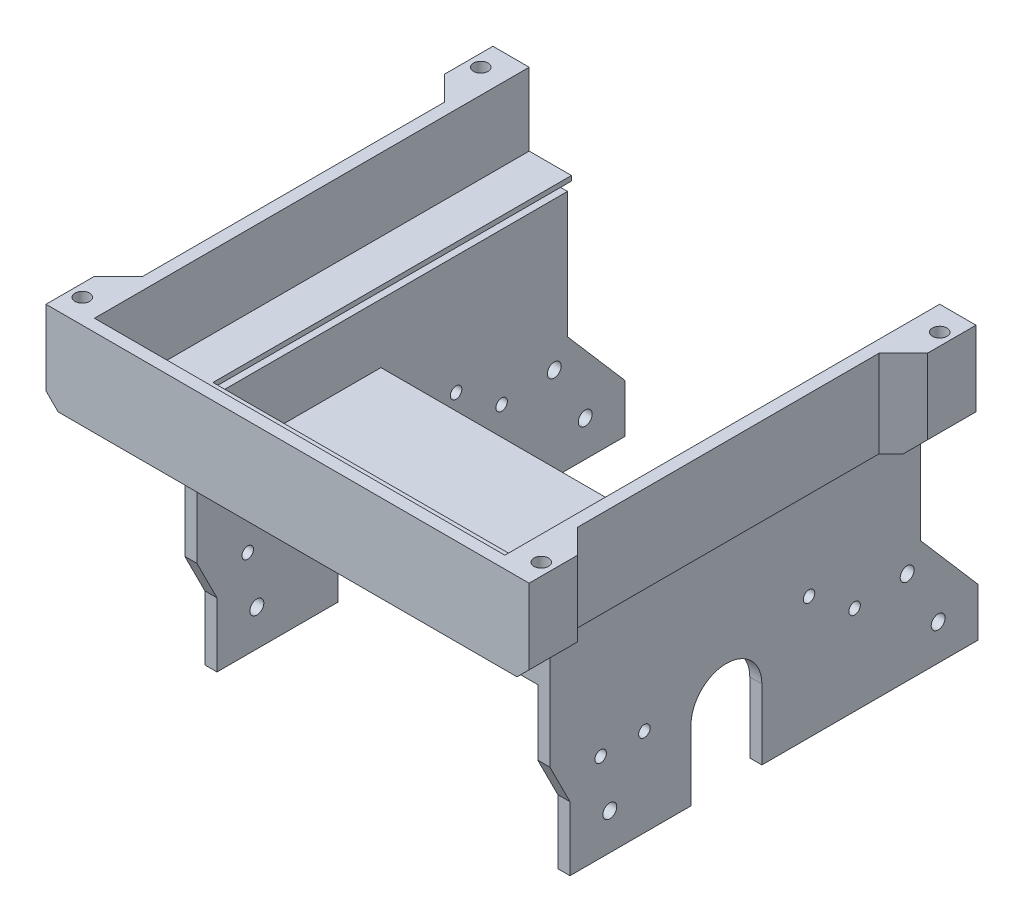
from build123d import *

# Parameters (mm, degrees)
SKETCH_1_W          = 9.5
SKETCH_1_H          = 8
EXTRUDE_1_DEPTH     = 2
SKETCH_2_R          = 1.15
SKETCH_2_R_2        = 0.95
CUT_EXTRUDE_1_DEPTH = 40.502623296
SKETCH_3_W          = 2
SKETCH_3_H          = 61.22
EXTRUDE_2_DEPTH     = 6
SKETCH_4_W          = 61.22
SKETCH_4_H          = 2
EXTRUDE_3_DEPTH     = 58.3
EXTRUDE_START       = -2
SKETCH_5_R          = 0.95
SKETCH_5_R_2        = 1.15
EXTRUDE_4_DEPTH     = 2
EXTRUDE_5_DEPTH     = 61.22
EXTRUDE_6_DEPTH     = 2
SKETCH_10_W         = 1.85
SKETCH_10_H         = 59.22
CUT_EXTRUDE_2_DEPTH = 0.2
SKETCH_11_W         = 0.12
SKETCH_11_H         = 1.8
CUT_EXTRUDE_4_DEPTH = 59.22
CUT_EXTRUDE_START   = -30.82
SKETCH_12_W         = 56.3
SKETCH_12_H         = 2
CUT_EXTRUDE_5_DEPTH = 30.82
EXTRUDE_7_DEPTH     = 10.6
SKETCH_14_W         = 71.82
SKETCH_14_H         = 2.4
EXTRUDE_8_DEPTH     = 1.32
SKETCH_15_W         = 71.82
SKETCH_15_H         = 2.4
EXTRUDE_9_DEPTH     = 2.48
EXTRUDE_10_DEPTH    = 2
SKETCH_17_W         = 73.82
SKETCH_17_H         = 2.4
EXTRUDE_11_DEPTH    = 2
SKETCH_18_W         = 73.82
SKETCH_18_H         = 2.4
EXTRUDE_12_DEPTH    = 2
EXTRUDE_13_DEPTH    = 12
SKETCH_20_W         = 4
SKETCH_20_H         = 8
SKETCH_20_R         = 1.2
EXTRUDE_14_DEPTH    = 10
SKETCH_21_W         = 4
SKETCH_21_H         = 8
EXTRUDE_15_DEPTH    = 3
SKETCH_22_W         = 4
SKETCH_22_H         = 8
EXTRUDE_16_DEPTH    = 4.4
CHAMFER_1_SIZE      = 4
CHAMFER_2_SIZE      = 2
CHAMFER_3_SIZE      = 5


with BuildPart() as part:
    # 草图1 → 凸台-拉伸1 (new body)
    with BuildSketch(Plane(origin=(0, 0, 0), x_dir=(0, 0, -1), z_dir=(1, 0, 0))):
        with BuildLine():
            Line((-2, -13.637332849), (24.2, -13.637332849))
            Line((24.2, -13.637332849), (24.2, -5.637332849))
            Line((24.2, -5.637332849), (24.2, 5.362667151))
            Line((24.2, 5.362667151), (24.2, 10.362667151))
            Line((24.2, 10.362667151), (-37.02, 10.362667151))
            Line((-37.02, 10.362667151), (-37.02, 3.562667151))
            Line((-37.02, 3.562667151), (-33.7, -3.037332849))
            Line((-33.7, -3.037332849), (-33.7, -13.637332849))
            Line((-33.7, -13.637332849), (-13.7, -13.637332849))
            Line((-13.7, -13.637332849), (-13.7, -2.037332849))
            ThreePointArc((-13.7, -2.037332849), (-7.85, 3.812667151), (-2, -2.037332849))
            Line((-2, -2.037332849), (-2, -13.637332849))
        make_face()
        Polygon((24.2, -5.637332849), (33.7, -5.637332849), (24.2, 5.362667151), align=None)
        with Locations((28.95, -9.637332849)):
            Rectangle(SKETCH_1_W, SKETCH_1_H)
    extrude(amount=EXTRUDE_1_DEPTH)

    # 草图2 → 切除-拉伸1 (cut, through all)
    with BuildSketch(Plane(origin=(2, 0, 0), x_dir=(0, 0, -1), z_dir=(1, 0, 0))):
        with Locations((27.12, -7.727332849)):
            Circle(SKETCH_2_R)
        with Locations((-27.12, -7.627332849)):
            Circle(SKETCH_2_R)
        with Locations((22, 1.712667151)):
            Circle(SKETCH_2_R)
        with Locations((13.31, 1.112667151)):
            Circle(SKETCH_2_R_2)
        with Locations((5.79, 6.592667151)):
            Circle(SKETCH_2_R_2)
        with Locations((-21.41, 0.912667151)):
            Circle(SKETCH_2_R_2)
        with Locations((-28.63, 0.912667151)):
            Circle(SKETCH_2_R_2)
    extrude(amount=-CUT_EXTRUDE_1_DEPTH, mode=Mode.SUBTRACT)

    # 草图3 → 凸台-拉伸2 (add)
    with BuildSketch(Plane(origin=(0, 10.362667151, 0), x_dir=(1, 0, 0), z_dir=(0, 1, 0))):
        with Locations((1, -6.41)):
            Rectangle(SKETCH_3_W, SKETCH_3_H)
    extrude(amount=EXTRUDE_2_DEPTH)

    # 草图4 → 凸台-拉伸3 (add)
    with BuildSketch(Plane.ZY):
        with Locations((6.41, 15.362667151)):
            Rectangle(SKETCH_4_W, SKETCH_4_H)
    extrude(amount=EXTRUDE_3_DEPTH)

    # 草图5 → 凸台-拉伸4 (add)
    with BuildSketch(Plane.ZY.offset(58.3).offset(EXTRUDE_START)):
        with BuildLine():
            Line((37.02, 14.362667151), (-24.2, 14.362667151))
            Line((-24.2, 14.362667151), (-24.2, 5.362667151))
            Line((-24.2, 5.362667151), (-33.7, -5.637332849))
            Line((-33.7, -5.637332849), (-33.7, -13.637332849))
            Line((-33.7, -13.637332849), (2, -13.637332849))
            Line((2, -13.637332849), (2, -2.037332849))
            ThreePointArc((2, -2.037332849), (7.85, 3.812667151), (13.7, -2.037332849))
            Line((13.7, -2.037332849), (13.7, -13.637332849))
            Line((13.7, -13.637332849), (33.7, -13.637332849))
            Line((33.7, -13.637332849), (33.7, -3.037332849))
            Line((33.7, -3.037332849), (37.02, 3.562667151))
            Line((37.02, 3.562667151), (37.02, 14.362667151))
        make_face()
        with Locations(Location((-13.31, 1.112667151, 0), (0, 0, 180))):
            Circle(SKETCH_5_R, mode=Mode.SUBTRACT)
        with Locations(Location((-22, 1.712667151, 0), (0, 0, 180))):
            Circle(SKETCH_5_R_2, mode=Mode.SUBTRACT)
        with Locations(Location((-27.12, -7.727332849, 0), (0, 0, 180))):
            Circle(SKETCH_5_R_2, mode=Mode.SUBTRACT)
        with Locations(Location((-5.79, 6.592667151, 0), (0, 0, 180))):
            Circle(SKETCH_5_R, mode=Mode.SUBTRACT)
        with Locations(Location((21.41, 0.912667151, 0), (0, 0, 180))):
            Circle(SKETCH_5_R, mode=Mode.SUBTRACT)
        with Locations(Location((28.63, 0.912667151, 0), (0, 0, 180))):
            Circle(SKETCH_5_R, mode=Mode.SUBTRACT)
        with Locations(Location((27.12, -7.627332849, 0), (0, 0, 180))):
            Circle(SKETCH_5_R_2, mode=Mode.SUBTRACT)
    extrude(amount=EXTRUDE_4_DEPTH)

    # 草图7 → 凸台-拉伸5 (add)
    with BuildSketch(Plane.XY.offset(37.02)):
        Polygon((-58.3, 21.362667151), (-58.3, 16.362667151), (-56.3, 16.362667151), (-56.3, 26.362667151), (-58.15, 26.362667151), (-58.15, 27.962667151), (-55.65, 27.962667151), (-55.65, 28.762667151), (-60.15, 28.762667151), (-60.15, 26.362667151), align=None)
        Polygon((0, 26.362667151), (0, 16.362667151), (2, 16.362667151), (2, 21.362667151), (3.85, 26.362667151), (3.85, 28.762667151), (-0.65, 28.762667151), (-0.65, 27.962667151), (1.85, 27.962667151), (1.85, 26.362667151), align=None)
    extrude(amount=-EXTRUDE_5_DEPTH)

    # 草图8 → 凸台-拉伸6 (add)
    with BuildSketch(Plane.XY.offset(37.02)):
        Polygon((-55.65, 28.762667151), (-0.65, 28.762667151), (-0.65, 27.962667151), (1.85, 27.962667151), (1.85, 26.362667151), (0, 26.362667151), (0, 16.362667151), (-56.3, 16.362667151), (-56.3, 26.362667151), (-58.15, 26.362667151), (-58.15, 27.962667151), (-55.65, 27.962667151), align=None)
        Polygon((0, 26.362667151), (0, 16.362667151), (-56.3, 16.362667151), (-56.3, 26.362667151), (-58.15, 26.362667151), (-58.15, 27.962667151), (-55.65, 27.962667151), (-55.65, 28.762667151), (-60.15, 28.762667151), (-60.15, 26.362667151), (-58.3, 21.362667151), (-58.3, 3.562667151), (-56.3, 3.562667151), (-56.3, 14.362667151), (0, 14.362667151), (0, 3.562667151), (2, 3.562667151), (2, 21.362667151), (3.85, 26.362667151), (3.85, 28.762667151), (-0.65, 28.762667151), (-0.65, 27.962667151), (1.85, 27.962667151), (1.85, 26.362667151), align=None)
    extrude(amount=-EXTRUDE_6_DEPTH)

    # 草图10 → 切除-拉伸2 (cut)
    with BuildSketch(Plane(origin=(0, 26.362667151, 0), x_dir=(1, 0, 0), z_dir=(0, 1, 0))):
        with Locations((0.925, -5.41)):
            Rectangle(SKETCH_10_W, SKETCH_10_H)
        with Locations((-57.225, -5.41)):
            Rectangle(SKETCH_10_W, SKETCH_10_H)
    extrude(amount=-CUT_EXTRUDE_2_DEPTH, mode=Mode.SUBTRACT)

    # 草图11 → 切除-拉伸4 (cut)
    with BuildSketch(Plane(origin=(0, 0, -24.2), x_dir=(-1, 0, 0), z_dir=(0, 0, -1))):
        with Locations((-1.91, 27.062667151)):
            Rectangle(SKETCH_11_W, SKETCH_11_H)
        with Locations((58.21, 27.062667151)):
            Rectangle(SKETCH_11_W, SKETCH_11_H)
    extrude(amount=-CUT_EXTRUDE_4_DEPTH, mode=Mode.SUBTRACT)

    # 草图12 → 切除-拉伸5 (cut)
    with BuildSketch(Plane(origin=(0, 0, -24.2), x_dir=(-1, 0, 0), z_dir=(0, 0, -1)).offset(CUT_EXTRUDE_START)):
        with Locations((28.15, 15.362667151)):
            Rectangle(SKETCH_12_W, SKETCH_12_H)
    extrude(amount=CUT_EXTRUDE_5_DEPTH, mode=Mode.SUBTRACT)

    # 草图13 → 凸台-拉伸7 (add)
    with BuildSketch(Plane.XY.offset(37.02)):
        Polygon((-58.3, 21.362667151), (2, 21.362667151), (3.85, 26.362667151), (3.85, 28.762667151), (-60.15, 28.762667151), (-60.15, 26.362667151), align=None)
    extrude(amount=EXTRUDE_7_DEPTH)

    # 草图14 → 凸台-拉伸8 (add)
    with BuildSketch(Plane(origin=(3.85, 0, 0), x_dir=(0, 0, -1), z_dir=(1, 0, 0))):
        with Locations((-11.71, 27.562667151)):
            Rectangle(SKETCH_14_W, SKETCH_14_H)
    extrude(amount=EXTRUDE_8_DEPTH)

    # 草图15 → 凸台-拉伸9 (add)
    with BuildSketch(Plane.ZY.offset(60.15)):
        with Locations((11.71, 27.562667151)):
            Rectangle(SKETCH_15_W, SKETCH_15_H)
    extrude(amount=EXTRUDE_9_DEPTH)

    # 草图16 → 凸台-拉伸10 (add)
    with BuildSketch(Plane.XY.offset(47.62)):
        Polygon((-58.3, 21.362667151), (2, 21.362667151), (3.85, 26.362667151), (5.17, 26.362667151), (5.17, 28.762667151), (-62.63, 28.762667151), (-62.63, 26.362667151), (-60.15, 26.362667151), align=None)
    extrude(amount=EXTRUDE_10_DEPTH)

    # 草图17 → 凸台-拉伸11 (add)
    with BuildSketch(Plane(origin=(5.17, 0, 0), x_dir=(0, 0, -1), z_dir=(1, 0, 0))):
        with Locations((-12.71, 27.562667151)):
            Rectangle(SKETCH_17_W, SKETCH_17_H)
    extrude(amount=EXTRUDE_11_DEPTH)

    # 草图18 → 凸台-拉伸12 (add)
    with BuildSketch(Plane.ZY.offset(62.63)):
        with Locations((12.71, 27.562667151)):
            Rectangle(SKETCH_18_W, SKETCH_18_H)
    extrude(amount=EXTRUDE_12_DEPTH)

    # 草图19 → 凸台-拉伸13 (add)
    with BuildSketch(Plane(origin=(0, 28.762667151, 0), x_dir=(1, 0, 0), z_dir=(0, 1, 0))):
        Polygon((-62.63, -47.62), (-62.63, 22.2), (-62.63, 24.2), (-64.63, 24.2), (-64.63, -49.62), (7.17, -49.62), (7.17, 24.2), (5.17, 24.2), (5.17, 22.2), (5.17, -47.62), align=None)
    extrude(amount=EXTRUDE_13_DEPTH)

    # 草图20 → 凸台-拉伸14 (add)
    # profile 1 of 4: a face of its own
    with BuildSketch(Plane(origin=(0, 40.762667151, 0), x_dir=(1, 0, 0), z_dir=(0, 1, 0))):
        with Locations((-66.63, -45.62)):
            Rectangle(SKETCH_20_W, SKETCH_20_H)
        with Locations(Location((-66.63, -45.62, 0), (0, 0, 270))):
            Circle(SKETCH_20_R, mode=Mode.SUBTRACT)
    # profile 2 of 4: a face of its own
    with BuildSketch(Plane(origin=(0, 40.762667151, 0), x_dir=(1, 0, 0), z_dir=(0, 1, 0))):
        with Locations((9.17, -45.62)):
            Rectangle(SKETCH_20_W, SKETCH_20_H)
        with Locations(Location((9.17, -45.62, 0), (0, 0, 270))):
            Circle(SKETCH_20_R, mode=Mode.SUBTRACT)
    # profile 3 of 4: a face of its own
    with BuildSketch(Plane(origin=(0, 40.762667151, 0), x_dir=(1, 0, 0), z_dir=(0, 1, 0))):
        with Locations((-66.63, 20.2)):
            Rectangle(SKETCH_20_W, SKETCH_20_H)
        with Locations(Location((-66.63, 20.2, 0), (0, 0, 270))):
            Circle(SKETCH_20_R, mode=Mode.SUBTRACT)
    # profile 4 of 4: a face of its own
    with BuildSketch(Plane(origin=(0, 40.762667151, 0), x_dir=(1, 0, 0), z_dir=(0, 1, 0))):
        with Locations((9.17, 20.2)):
            Rectangle(SKETCH_20_W, SKETCH_20_H)
        with Locations(Location((9.17, 20.2, 0), (0, 0, 270))):
            Circle(SKETCH_20_R, mode=Mode.SUBTRACT)
    extrude(amount=-EXTRUDE_14_DEPTH)

    # 草图21 → 凸台-拉伸15 (add)
    with BuildSketch(Plane.XZ.offset(-30.762667151)):
        with Locations((-66.63, -20.2)):
            Rectangle(SKETCH_21_W, SKETCH_21_H)
        with Locations((-66.63, 45.62)):
            Rectangle(SKETCH_21_W, SKETCH_21_H)
        with Locations((9.17, -20.2)):
            Rectangle(SKETCH_21_W, SKETCH_21_H)
        with Locations((9.17, 45.62)):
            Rectangle(SKETCH_21_W, SKETCH_21_H)
    extrude(amount=-EXTRUDE_15_DEPTH)

    # 草图22 → 凸台-拉伸16 (add)
    with BuildSketch(Plane.XZ.offset(-30.762667151)):
        with Locations((-66.63, 45.62)):
            Rectangle(SKETCH_22_W, SKETCH_22_H)
        with Locations((-66.63, -20.2)):
            Rectangle(SKETCH_22_W, SKETCH_22_H)
        with Locations((9.17, -20.2)):
            Rectangle(SKETCH_22_W, SKETCH_22_H)
        with Locations((9.17, 45.62)):
            Rectangle(SKETCH_22_W, SKETCH_22_H)
    extrude(amount=EXTRUDE_16_DEPTH)

    # 倒角1
    chamfer_1_edges = [part.edges().sort_by_distance(p)[0] for p in [
        (-64.63, 33.562667151, 41.62),
        (7.17, 33.562667151, 41.62),
        (-64.63, 33.562667151, -16.2),
        (7.17, 33.562667151, -16.2),
    ]]
    chamfer(chamfer_1_edges, length=CHAMFER_1_SIZE - 0.0001)  # a hair under: the kernel refuses the full size

    # 倒角2
    chamfer_2_edges = [part.edges().sort_by_distance(p)[0] for p in [
        (-68.63, 26.362667151, 45.62),
        (-68.63, 26.362667151, -20.2),
        (11.17, 26.362667151, -20.2),
        (11.17, 26.362667151, 45.62),
    ]]
    chamfer(chamfer_2_edges, length=CHAMFER_2_SIZE)

    # 倒角3
    chamfer_3_edges = [part.edges().sort_by_distance(p)[0] for p in [
        (-28.15, 21.362667151, 49.62),
    ]]
    chamfer(chamfer_3_edges, length=CHAMFER_3_SIZE)


solid = part.part
